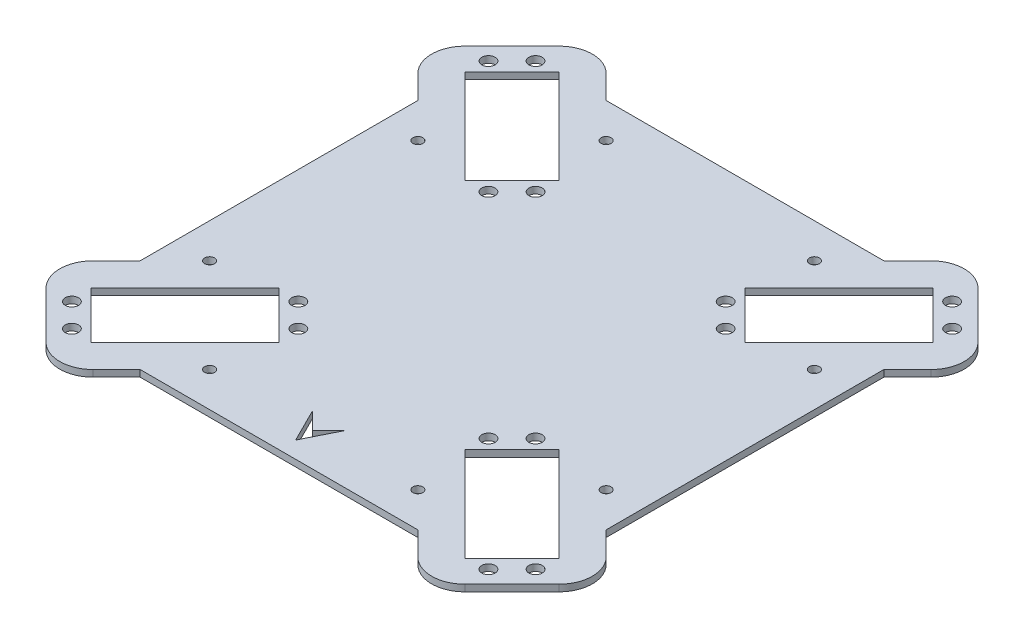
from build123d import *

# Parameters (mm, degrees)
SKETCH1_W           = 140
SKETCH1_H           = 140
BOSS_EXTRUDE1_DEPTH = 2
BOSS_EXTRUDE3_DEPTH = 2
SKETCH3_R           = 2
CUT_EXTRUDE1_DEPTH  = 2
FILLET1_R           = 10
SKETCH4_R           = 1.5
CUT_EXTRUDE2_DEPTH  = 2
CUT_EXTRUDE3_DEPTH  = 2


with BuildPart() as part:
    # Sketch1 → Boss-Extrude1 (new body)
    with BuildSketch(Plane(origin=(0, 0, 0), x_dir=(1, 0, 0), z_dir=(0, 1, 0))):
        with Locations((70, 70)):
            Rectangle(SKETCH1_W, SKETCH1_H)
    extrude(amount=BOSS_EXTRUDE1_DEPTH)

    # Sketch2 → Boss-Extrude3 (add)
    with BuildSketch(Plane(origin=(0, 2, 0), x_dir=(1, 0, 0), z_dir=(0, 1, 0))):
        Polygon((111.715728753, 140), (140, 111.715728753), (154.142135624, 125.857864376), (125.857864376, 154.142135624), align=None)
        Polygon((0, 111.715728753), (-14.142135624, 125.857864376), (14.142135624, 154.142135624), (28.284271247, 140), align=None)
        Polygon((28.284271247, 0), (0, 28.284271247), (-14.142135624, 14.142135624), (14.142135624, -14.142135624), align=None)
        Polygon((140, 28.284271247), (154.142135624, 14.142135624), (125.857864376, -14.142135624), (111.715728753, 0), align=None)
    extrude(amount=-BOSS_EXTRUDE3_DEPTH)

    # Sketch3 → Cut-Extrude1 (cut)
    with BuildSketch(Plane(origin=(0, 2, 0), x_dir=(1, 0, 0), z_dir=(0, 1, 0))):
        with Locations((7.424621202, 0.353553391)):
            Circle(SKETCH3_R)
        with Locations((0.353553391, 7.424621202)):
            Circle(SKETCH3_R)
        with Locations((41.443528445, 34.372460633)):
            Circle(SKETCH3_R)
        with Locations((34.372460633, 41.443528445)):
            Circle(SKETCH3_R)
        with Locations((132.575378798, 0.353553391)):
            Circle(SKETCH3_R)
        with Locations((139.646446609, 7.424621202)):
            Circle(SKETCH3_R)
        with Locations((98.556471555, 34.372460633)):
            Circle(SKETCH3_R)
        with Locations((105.627539367, 41.443528445)):
            Circle(SKETCH3_R)
        with Locations((132.575378798, 139.646446609)):
            Circle(SKETCH3_R)
        with Locations((139.646446609, 132.575378798)):
            Circle(SKETCH3_R)
        with Locations((98.556471555, 105.627539367)):
            Circle(SKETCH3_R)
        with Locations((105.627539367, 98.556471555)):
            Circle(SKETCH3_R)
        with Locations((7.424621202, 139.646446609)):
            Circle(SKETCH3_R)
        with Locations((0.353553391, 132.575378798)):
            Circle(SKETCH3_R)
        with Locations((41.443528445, 105.627539367)):
            Circle(SKETCH3_R)
        with Locations((34.372460633, 98.556471555)):
            Circle(SKETCH3_R)
        Polygon((13.795653301, -0.346482323), (42.079924548, 27.937788925), (27.937788925, 42.079924548), (-0.346482323, 13.795653301), align=None)
        Polygon((97.920075452, 27.937788925), (112.062211075, 42.079924548), (140.346482323, 13.795653301), (126.204346699, -0.346482323), align=None)
        Polygon((126.204346699, 140.346482323), (97.920075452, 112.062211075), (112.062211075, 97.920075452), (140.346482323, 126.204346699), align=None)
        Polygon((42.079924548, 112.062211075), (27.937788925, 97.920075452), (-0.346482323, 126.204346699), (13.795653301, 140.346482323), align=None)
    extrude(amount=-CUT_EXTRUDE1_DEPTH, mode=Mode.SUBTRACT)

    # Fillet1
    fillet1_edges = [part.edges().sort_by_distance(p)[0] for p in [
        (154.142135624, 1, -14.142135624),
        (125.857864376, 1, 14.142135624),
        (14.142135624, 1, 14.142135624),
        (-14.142135624, 1, -14.142135624),
        (-14.142135624, 1, -125.857864376),
        (14.142135624, 1, -154.142135624),
        (125.857864376, 1, -154.142135624),
        (154.142135624, 1, -125.857864376),
    ]]
    fillet(fillet1_edges, radius=FILLET1_R)

    # Sketch4 → Cut-Extrude2 (cut)
    with BuildSketch(Plane(origin=(0, 2, 0), x_dir=(1, 0, 0), z_dir=(0, 1, 0))):
        with Locations((38.717631804, 10.433360556)):
            Circle(SKETCH4_R)
        with Locations((10.433360556, 38.717631804)):
            Circle(SKETCH4_R)
        with Locations((101.282368196, 10.433360556)):
            Circle(SKETCH4_R)
        with Locations((129.566639444, 38.717631804)):
            Circle(SKETCH4_R)
        with Locations((38.717631804, 129.566639444)):
            Circle(SKETCH4_R)
        with Locations((10.433360556, 101.282368196)):
            Circle(SKETCH4_R)
        with Locations((101.282368196, 129.566639444)):
            Circle(SKETCH4_R)
        with Locations((129.566639444, 101.282368196)):
            Circle(SKETCH4_R)
    extrude(amount=-CUT_EXTRUDE2_DEPTH, mode=Mode.SUBTRACT)

    # Sketch5 → Cut-Extrude3 (cut)
    with BuildSketch(Plane(origin=(0, 2, 0), x_dir=(1, 0, 0), z_dir=(0, 1, 0))):
        Polygon((75, 15), (70, 10), (65, 15), (70, 5), align=None)
    extrude(amount=-CUT_EXTRUDE3_DEPTH, mode=Mode.SUBTRACT)


solid = part.part
